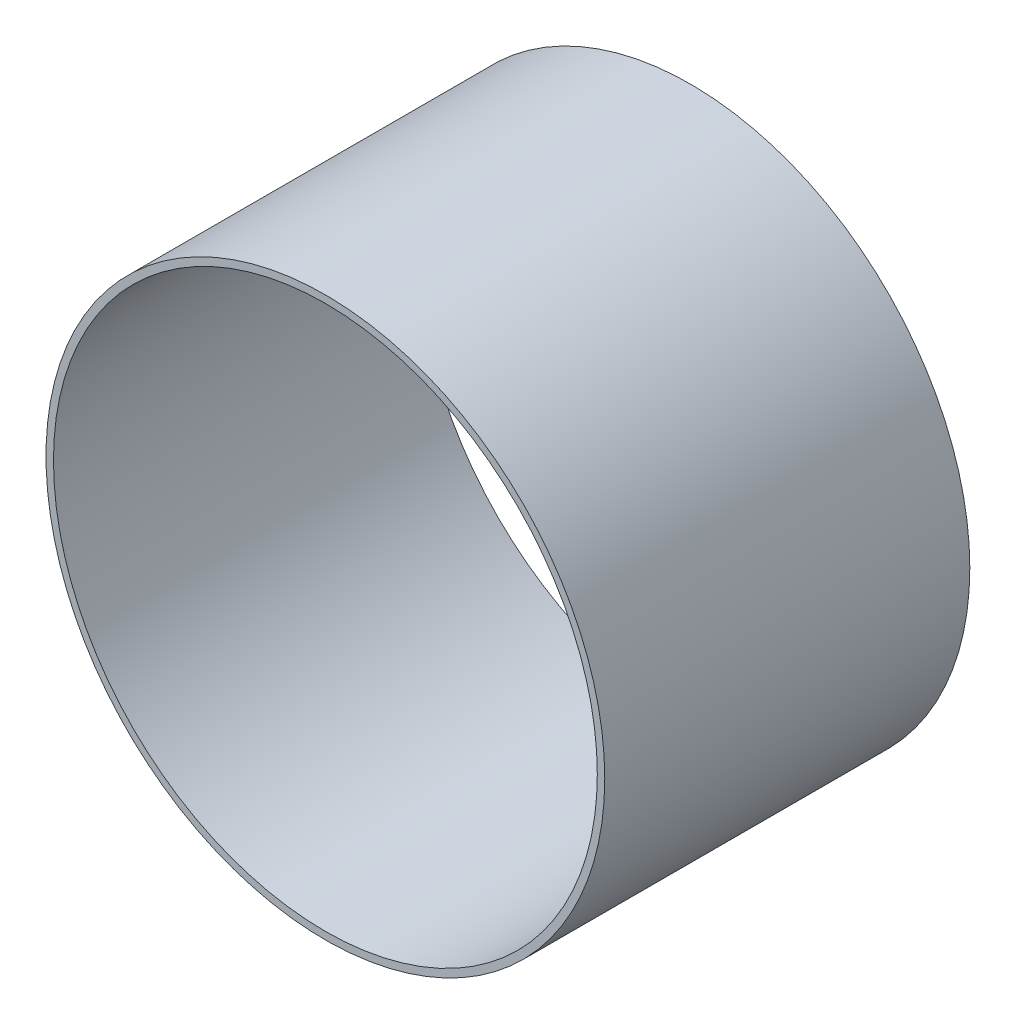
from build123d import *

# Parameters (mm, degrees)
SCHIZZO1_R                = 75
SCHIZZO1_R_2              = 73
ESTRUSIONE_SOTTILE1_DEPTH = 98


with BuildPart() as part:
    # Schizzo1 → Estrusione-Sottile1 (new body)
    with BuildSketch(Plane.XY):
        Circle(SCHIZZO1_R)
        Circle(SCHIZZO1_R_2, mode=Mode.SUBTRACT)
    extrude(amount=ESTRUSIONE_SOTTILE1_DEPTH)


solid = part.part
